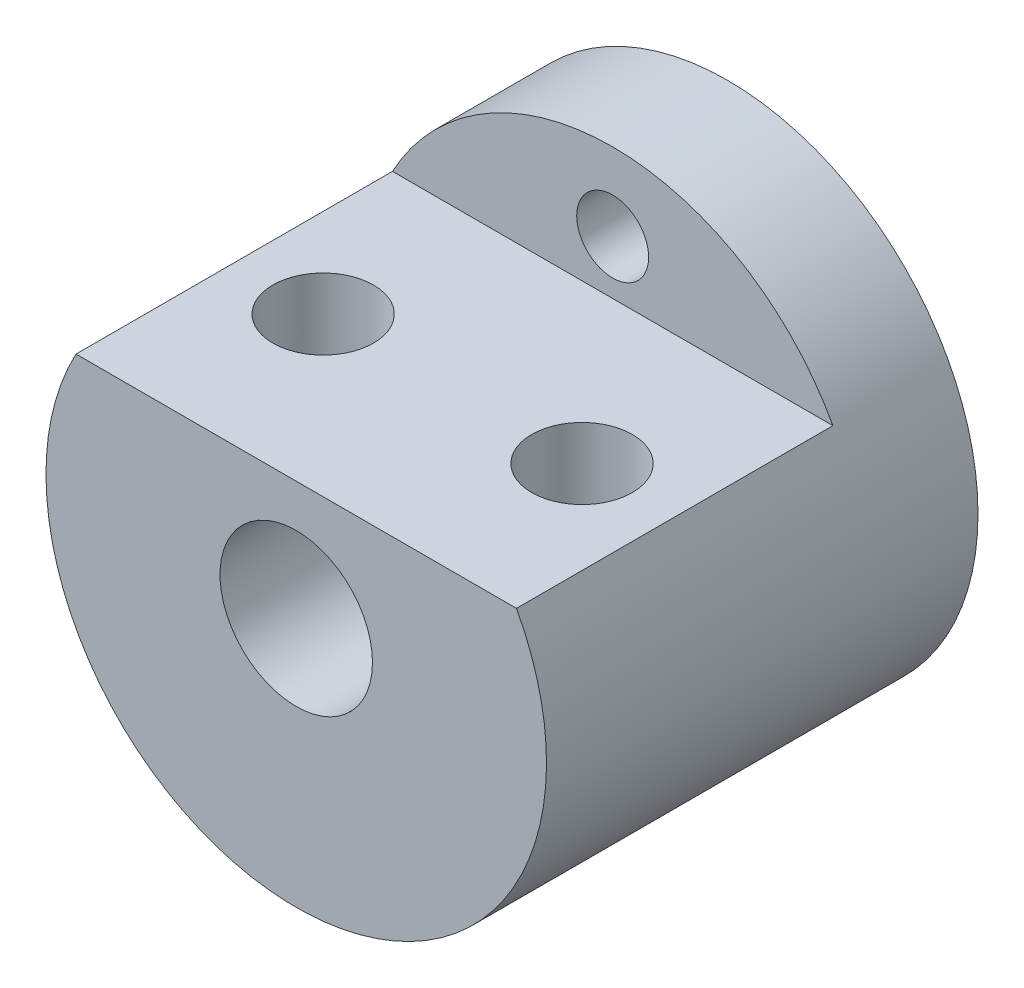
from build123d import *

# Parameters (mm, degrees)
SKETCH1_R               = 8.7
BOSS_EXTRUDE1_DEPTH     = 15
SKETCH5_R               = 1.75
CUT_EXTRUDE1_DEPTH      = 20.400515457
SKETCH4_R               = 1.25
CUT_EXTRUDE2_DEPTH      = 7
SKETCH6_R               = 2.65
CUT_EXTRUDE3_DEPTH      = 6.4
SKETCH2_W               = 17
SKETCH2_H               = 4.566888769
CUT_EXTRUDE4_DEPTH      = 11
FILLET1_R               = 0.3
CUT_EXTRUDE6_DEPTH      = 22.572638779
CUT_EXTRUDE6_DEPTH_BACK = 22.572638779
SKETCH8_R               = 1.75


with BuildPart() as part:
    # Sketch1 → Boss-Extrude1 (new body)
    with BuildSketch(Plane.XY):
        Circle(SKETCH1_R)
    extrude(amount=BOSS_EXTRUDE1_DEPTH)

    # Sketch5 → Cut-Extrude1 (cut, through all)
    with BuildSketch(Plane(origin=(0, 0, 0), x_dir=(-1, 0, 0), z_dir=(0, 0, -1))):
        Circle(SKETCH5_R)
    extrude(amount=-CUT_EXTRUDE1_DEPTH, mode=Mode.SUBTRACT)

    # Sketch4 → Cut-Extrude2 (cut)
    with BuildSketch(Plane(origin=(0, 0, 0), x_dir=(-1, 0, 0), z_dir=(0, 0, -1))):
        with Locations((0, 6)):
            Circle(SKETCH4_R)
        with Locations((6, 0)):
            Circle(SKETCH4_R)
        with Locations((0, -6)):
            Circle(SKETCH4_R)
        with Locations((-6, 0)):
            Circle(SKETCH4_R)
    extrude(amount=-CUT_EXTRUDE2_DEPTH, mode=Mode.SUBTRACT)

    # Sketch6 → Cut-Extrude3 (cut)
    with BuildSketch(Plane.XY.offset(15)):
        Circle(SKETCH6_R)
    extrude(amount=-CUT_EXTRUDE3_DEPTH, mode=Mode.SUBTRACT)

    # Sketch2 → Cut-Extrude4 (cut)
    with BuildSketch(Plane.XY.offset(15)):
        with Locations((0.844453543, 6.416555616)):
            Rectangle(SKETCH2_W, SKETCH2_H)
    extrude(amount=-CUT_EXTRUDE4_DEPTH, mode=Mode.SUBTRACT)

    # Fillet1
    fillet1_edges = [part.edges().sort_by_distance(p)[0] for p in [
        (1.75, 0, 8.6),
    ]]
    fillet(fillet1_edges, radius=FILLET1_R)

    # Sketch8 → Cut-Extrude6 (cut, two sides: drawn at the far end of the back side and taken through both)
    with BuildSketch(Plane(origin=(0, 4.133111231, 0), x_dir=(1, 0, 0), z_dir=(0, 1, 0)).offset(-CUT_EXTRUDE6_DEPTH_BACK)):
        with Locations((-4.564549334, -9.5)):
            Circle(SKETCH8_R)
        with Locations((4.435450666, -9.5)):
            Circle(SKETCH8_R)
    extrude(amount=CUT_EXTRUDE6_DEPTH + CUT_EXTRUDE6_DEPTH_BACK, mode=Mode.SUBTRACT)


solid = part.part
